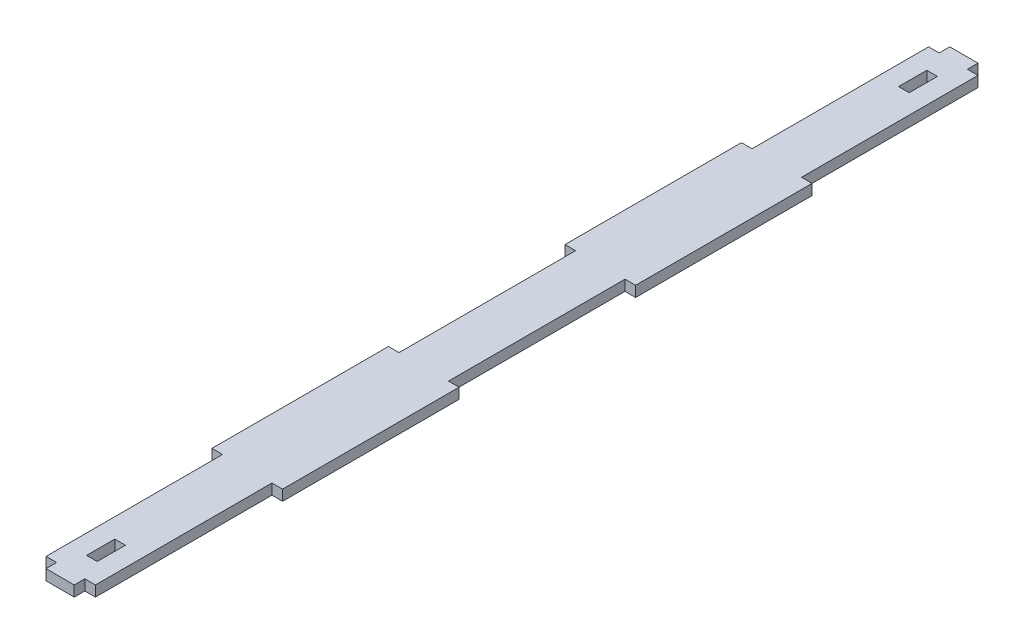
from build123d import *

# Parameters (mm, degrees)
SALIENTE_EXTRUIR1_DEPTH = 3


with BuildPart() as part:
    # Croquis1 → Saliente-Extruir1 (new body)
    with BuildSketch(Plane(origin=(0, 0, 0), x_dir=(1, 0, 0), z_dir=(0, 1, 0))):
        Polygon((14, 253.116176228), (10, 253.116176228), (6, 253.116176228), (6, 250.116176228), (3, 250.116176228), (3, 200.116176228), (0, 200.116176228), (0, 150.116176228), (3, 150.116176228), (3, 100.116176228), (0, 100.116176228), (0, 50.116176228), (3, 50.116176228), (3, 0.116176228), (6, 0.116176228), (6, -2.883823772), (14, -2.883823772), (14, 0.116176228), (17, 0.116176228), (17, 50.116176228), (20, 50.116176228), (20, 100.116176228), (17, 100.116176228), (17, 150.116176228), (20, 150.116176228), (20, 200.116176228), (17, 200.116176228), (17, 250.116176228), (14, 250.116176228), align=None)
        Polygon((11.5, 14.116176228), (11.5, 6.116176228), (10, 6.116176228), (8.5, 6.116176228), (8.5, 14.116176228), align=None, mode=Mode.SUBTRACT)
        Polygon((8.5, 244.116176228), (10, 244.116176228), (11.5, 244.116176228), (11.5, 236.116176228), (8.5, 236.116176228), align=None, mode=Mode.SUBTRACT)
    extrude(amount=SALIENTE_EXTRUIR1_DEPTH)


solid = part.part
